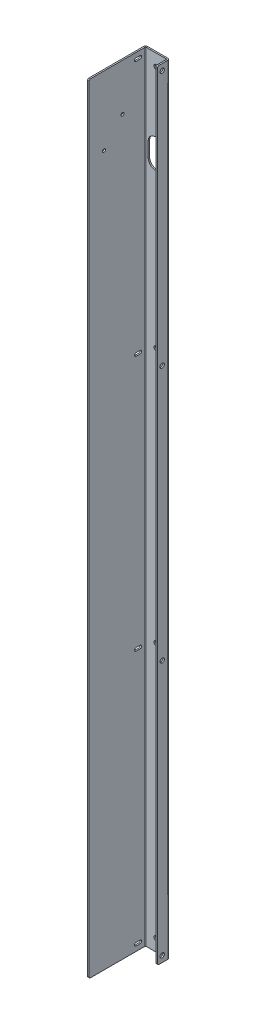
from build123d import *

# Parameters (mm, degrees)
BASE_FLANGE1_DEPTH = 1613
CUT_EXTRUDE1_REACH = 1620.23
FILLET1_R          = 3
CUT_EXTRUDE2_REACH = 1620.23
SKETCH7_R          = 4.5
LPATTERN1_COUNT    = 4
LPATTERN1_PITCH    = 529
CUT_EXTRUDE3_REACH = 1620.23
SKETCH8_R          = 3.25
CUT_EXTRUDE4_REACH = 1619.431
CUT_EXTRUDE5_REACH = 1619.431
SKETCH10_R         = 4.5
LPATTERN2_COUNT    = 3
LPATTERN2_PITCH    = 529
CUT_EXTRUDE6_REACH = 1619.431
SKETCH11_R         = 4.5


# Sheet-metal steps are written as plain solids
with BuildPart() as part:
    # Sketch1 → Base-Flange1 (new body)
    with BuildSketch(Plane(origin=(0, 0, 0), x_dir=(1, 0, 0), z_dir=(0, 1, 0))):
        with BuildLine():
            Line((-25, -120), (-25, -4.5))
            ThreePointArc((-25, -4.5), (-23.681980515, -1.318019485), (-20.5, 0))
            Line((-20.5, 0), (20.5, 0))
            ThreePointArc((20.5, 0), (23.681980515, -1.318019485), (25, -4.5))
            Line((25, -4.5), (25, -25))
            Line((25, -25), (22, -25))
            Line((22, -25), (22, -4.5))
            ThreePointArc((22, -4.5), (21.560660172, -3.439339828), (20.5, -3))
            Line((20.5, -3), (-20.5, -3))
            ThreePointArc((-20.5, -3), (-21.560660172, -3.439339828), (-22, -4.5))
            Line((-22, -4.5), (-22, -120))
            Line((-22, -120), (-25, -120))
        make_face()
    extrude(amount=BASE_FLANGE1_DEPTH)

    # Sketch6 → Cut-Extrude1 (cut, up to next)
    with BuildSketch(Plane.ZY.offset(25), mode=Mode.PRIVATE) as cut_extrude1_sk1:
        with BuildLine():
            Line((14.5, 16.25), (22.5, 16.25))
            ThreePointArc((22.5, 16.25), (25.75, 13), (22.5, 9.75))
            Line((22.5, 9.75), (14.5, 9.75))
            ThreePointArc((14.5, 9.75), (11.25, 13), (14.5, 16.25))
        make_face()
    cut_extrude1_tool1 = extrude(cut_extrude1_sk1.sketch, amount=-CUT_EXTRUDE1_REACH, mode=Mode.PRIVATE) & part.part
    cut_extrude1 = cut_extrude1_tool1.solids().sort_by_distance((-25, 13, 18.5))[0]
    add(cut_extrude1, mode=Mode.SUBTRACT)

    # Fillet1
    fillet1_edges = [part.edges().sort_by_distance(p)[0] for p in [
        (23.5, 0, 25),
        (-23.5, 0, 120),
        (23.5, 1613, 25),
        (-23.5, 1613, 120),
    ]]
    fillet(fillet1_edges, radius=FILLET1_R)

    # Sketch7 → Cut-Extrude2 (cut, up to next)
    with BuildSketch(Plane(origin=(25, 0, 0), x_dir=(0, 0, -1), z_dir=(1, 0, 0)), mode=Mode.PRIVATE) as cut_extrude2_sk1:
        with Locations((-15.5, 13)):
            Circle(SKETCH7_R)
    cut_extrude2_tool1 = extrude(cut_extrude2_sk1.sketch, amount=-CUT_EXTRUDE2_REACH, mode=Mode.PRIVATE) & part.part
    cut_extrude2 = cut_extrude2_tool1.solids().sort_by_distance((25, 13, 15.5))[0]
    add(cut_extrude2, mode=Mode.SUBTRACT)

    # LPattern1: Cut-Extrude1, Cut-Extrude2 ×4
    with Locations(*[(0, i * LPATTERN1_PITCH, 0) for i in range(1, LPATTERN1_COUNT)]):
        add(cut_extrude1, mode=Mode.SUBTRACT)
        add(cut_extrude2, mode=Mode.SUBTRACT)

    # Sketch8 → Cut-Extrude3 (cut, up to next)
    with BuildSketch(Plane.ZY.offset(25), mode=Mode.PRIVATE) as cut_extrude3_sk1:
        with Locations((50.716371709, 1515.981333294)):
            Circle(SKETCH8_R)
    cut_extrude3_tool1 = extrude(cut_extrude3_sk1.sketch, amount=-CUT_EXTRUDE3_REACH, mode=Mode.PRIVATE) & part.part
    # Sketch8 → Cut-Extrude3 (cut, up to next)
    with BuildSketch(Plane.ZY.offset(25), mode=Mode.PRIVATE) as cut_extrude3_sk2:
        with Locations((89.283628291, 1470.018666706)):
            Circle(SKETCH8_R)
    cut_extrude3_tool2 = extrude(cut_extrude3_sk2.sketch, amount=-CUT_EXTRUDE3_REACH, mode=Mode.PRIVATE) & part.part
    add(cut_extrude3_tool1.solids().sort_by_distance((-25, 1515.981333, 50.716372))[0], mode=Mode.SUBTRACT)
    add(cut_extrude3_tool2.solids().sort_by_distance((-25, 1470.018667, 89.283628))[0], mode=Mode.SUBTRACT)

    # Sketch9 → Cut-Extrude4 (cut, up to next)
    with BuildSketch(Plane.XY.offset(3), mode=Mode.PRIVATE) as cut_extrude4_sk1:
        with BuildLine():
            Line((-16.5, 1417), (-16.5, 1447))
            ThreePointArc((-16.5, 1447), (-1.5, 1462), (13.5, 1447))
            Line((13.5, 1447), (13.5, 1417))
            ThreePointArc((13.5, 1417), (-1.5, 1402), (-16.5, 1417))
        make_face()
    cut_extrude4_tool1 = extrude(cut_extrude4_sk1.sketch, amount=-CUT_EXTRUDE4_REACH, mode=Mode.PRIVATE) & part.part
    add(cut_extrude4_tool1.solids().sort_by_distance((-1.5, 1432, 3))[0], mode=Mode.SUBTRACT)

    # Sketch10 → Cut-Extrude5 (cut, up to next)
    with BuildSketch(Plane.XY.offset(3), mode=Mode.PRIVATE) as cut_extrude5_sk1:
        with Locations((0, 25)):
            Circle(SKETCH10_R)
    cut_extrude5_tool1 = extrude(cut_extrude5_sk1.sketch, amount=-CUT_EXTRUDE5_REACH, mode=Mode.PRIVATE) & part.part
    cut_extrude5 = cut_extrude5_tool1.solids().sort_by_distance((0, 25, 3))[0]
    add(cut_extrude5, mode=Mode.SUBTRACT)

    # LPattern2: Cut-Extrude5 ×3
    with Locations(*[(0, i * LPATTERN2_PITCH, 0) for i in range(1, LPATTERN2_COUNT)]):
        add(cut_extrude5, mode=Mode.SUBTRACT)

    # Sketch11 → Cut-Extrude6 (cut, up to next)
    with BuildSketch(Plane.XY.offset(3), mode=Mode.PRIVATE) as cut_extrude6_sk1:
        with Locations((0, 1588)):
            Circle(SKETCH11_R)
    cut_extrude6_tool1 = extrude(cut_extrude6_sk1.sketch, amount=-CUT_EXTRUDE6_REACH, mode=Mode.PRIVATE) & part.part
    add(cut_extrude6_tool1.solids().sort_by_distance((0, 1588, 3))[0], mode=Mode.SUBTRACT)


solid = part.part
